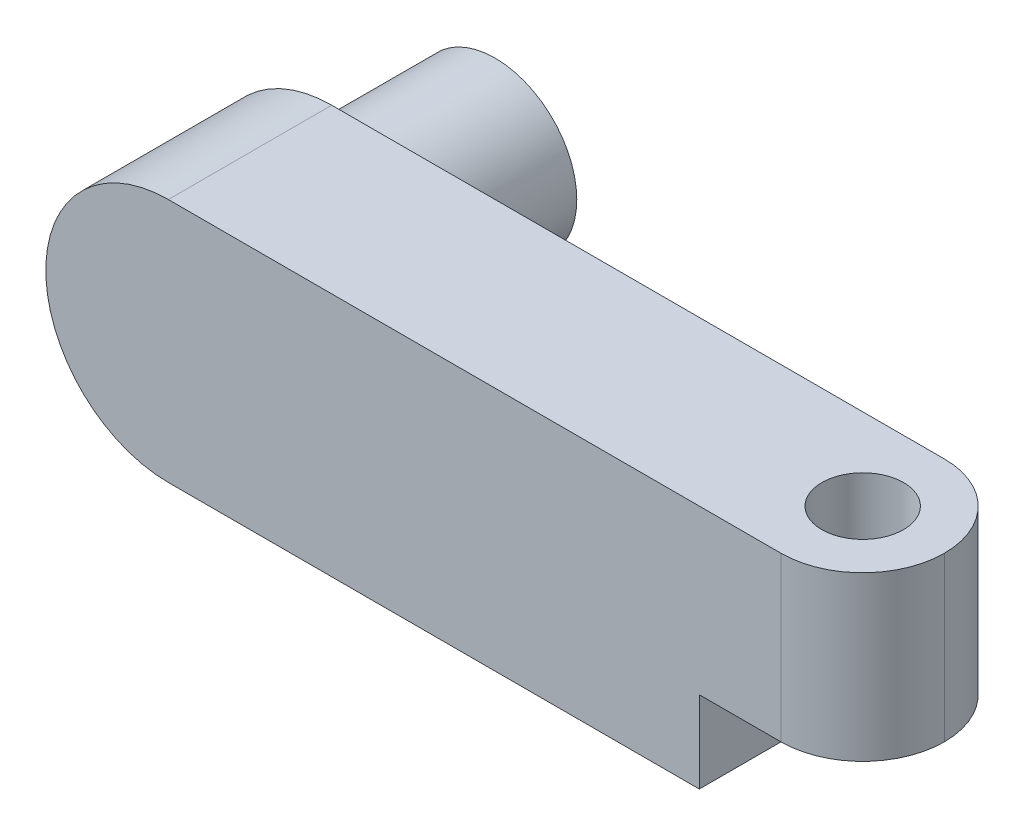
from build123d import *

# Parameters (mm, degrees)
BOSS_EXTRUDE1_DEPTH = 20
FILLET1_R           = 10
CUT_EXTRUDE1_REACH  = 94.331
SKETCH4_R           = 5
SKETCH5_R           = 10
BOSS_EXTRUDE2_DEPTH = 20


with BuildPart() as part:
    # Sketch1 → Boss-Extrude1 (new body)
    with BuildSketch(Plane.XY):
        with BuildLine():
            Line((0, 15), (85, 15))
            Line((85, 15), (85, -5))
            Line((85, -5), (65, -5))
            Line((65, -5), (65, -15))
            Line((65, -15), (0, -15))
            ThreePointArc((0, -15), (-15, 0), (0, 15))
        make_face()
    extrude(amount=-BOSS_EXTRUDE1_DEPTH)

    # Fillet1
    fillet1_edges = [part.edges().sort_by_distance(p)[0] for p in [
        (85, 5, 0),
        (85, 5, -20),
    ]]
    fillet(fillet1_edges, radius=FILLET1_R - 0.0001)  # a hair under: the kernel refuses the full size

    # Sketch4 → Cut-Extrude1 (cut, up to next)
    with BuildSketch(Plane(origin=(0, 15, 0), x_dir=(1, 0, 0), z_dir=(0, 1, 0)), mode=Mode.PRIVATE) as cut_extrude1_sk1:
        with Locations(Location((75, 10, 0), (0, 0, 270))):
            Circle(SKETCH4_R)
    cut_extrude1_tool1 = extrude(cut_extrude1_sk1.sketch, amount=-CUT_EXTRUDE1_REACH, mode=Mode.PRIVATE) & part.part
    add(cut_extrude1_tool1.solids().sort_by_distance((75, 15, -10))[0], mode=Mode.SUBTRACT)

    # Sketch5 → Boss-Extrude2 (add)
    with BuildSketch(Plane(origin=(0, 0, -20), x_dir=(-1, 0, 0), z_dir=(0, 0, -1))):
        with Locations(Location((0, 0, 0), (0, 0, 180))):
            Circle(SKETCH5_R)
    extrude(amount=BOSS_EXTRUDE2_DEPTH)


solid = part.part
